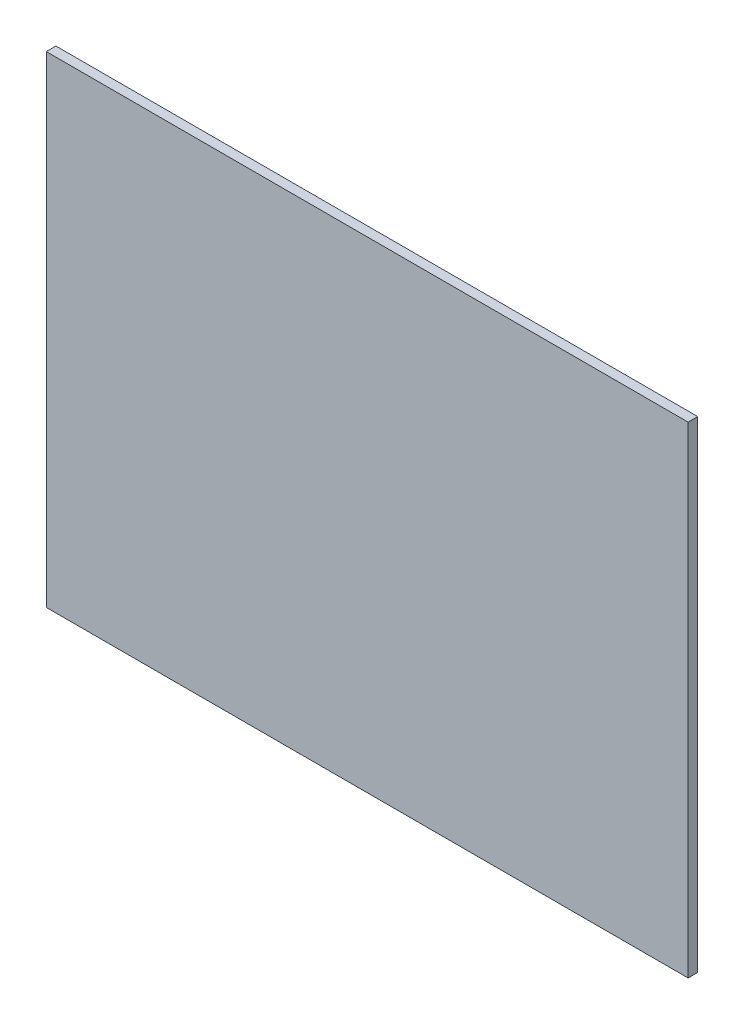
from build123d import *

# Parameters (mm, degrees)
SKETCH1_W           = 200
SKETCH1_H           = 150
BOSS_EXTRUDE1_DEPTH = 3


with BuildPart() as part:
    # Sketch1 → Boss-Extrude1 (new body)
    with BuildSketch(Plane.XY):
        Rectangle(SKETCH1_W, SKETCH1_H)
    extrude(amount=BOSS_EXTRUDE1_DEPTH)


solid = part.part
